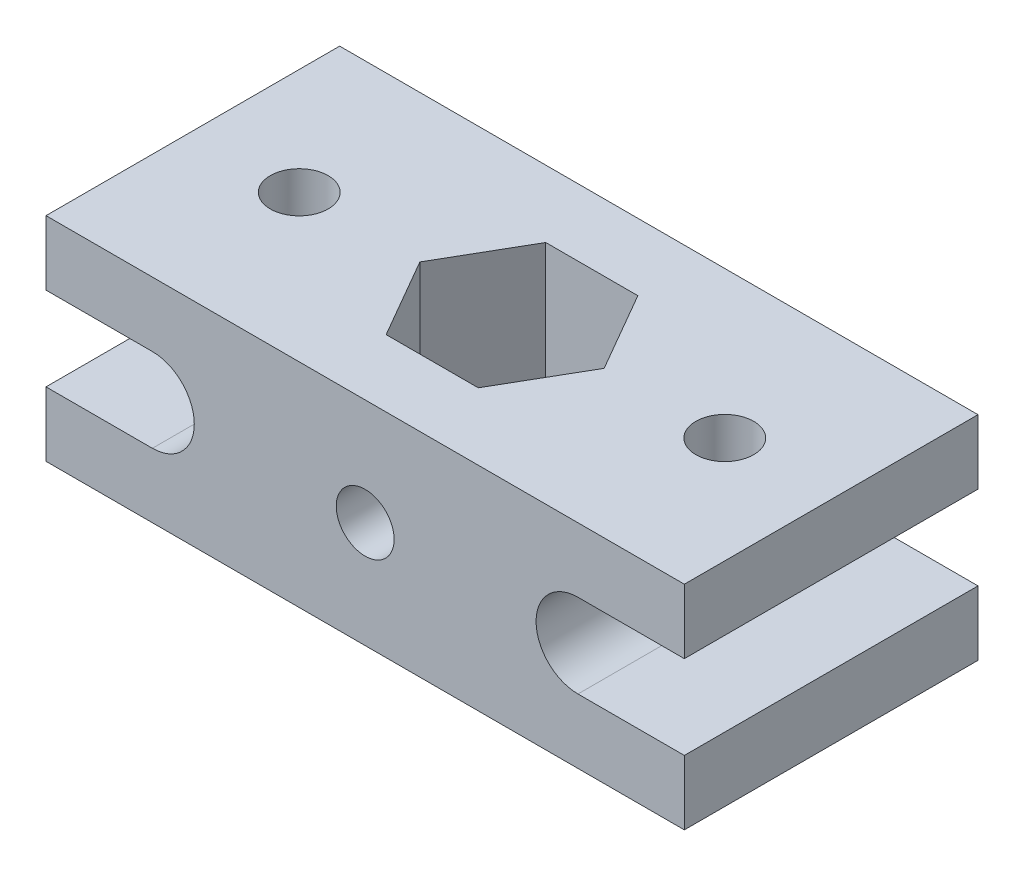
from build123d import *

# Parameters (mm, degrees)
SKETCH1_W                  = 38.1
SKETCH1_H                  = 17.526
BOSS_EXTRUDE1_DEPTH        = 12.7
CUT_EXTRUDE1_DEPTH         = 25.4
F_8_32_TAPPED_HOLE1_REACH  = 26.515
F_8_32_TAPPED_HOLE1_BORE_R = 1.7272
MIRROR1_START              = -8.763
MIRROR1_DEPTH              = 17.526
MIRROR1_START_2            = 8.85
MIRROR1_2_OUTLINE_R        = 1.7272
MIRROR1_2_DEPTH            = 5.15
F_8_32_TAPPED_HOLE2_D      = 3.4544
F_8_32_TAPPED_HOLE2_DEPTH  = 10.668
F_8_32_TAPPED_HOLE2_TIP    = 1.037806461


with BuildPart() as part:
    # Sketch1 → Boss-Extrude1 (new body)
    with BuildSketch(Plane(origin=(0, 0, 0), x_dir=(1, 0, 0), z_dir=(0, 1, 0))):
        Rectangle(SKETCH1_W, SKETCH1_H)
        Polygon((5.499261314, 0), (2.749630657, 4.7625), (-2.749630657, 4.7625), (-5.499261314, 0), (-2.749630657, -4.7625), (2.749630657, -4.7625), align=None, mode=Mode.SUBTRACT)
    extrude(amount=BOSS_EXTRUDE1_DEPTH)

    # Sketch2 → Cut-Extrude1 (cut)
    with BuildSketch(Plane.XY.offset(8.763)):
        with BuildLine():
            Line((12.7, 8.85), (19.05, 8.85))
            ThreePointArc((19.05, 8.85), (21.55, 6.35), (19.05, 3.85))
            Line((19.05, 3.85), (12.7, 3.85))
            ThreePointArc((12.7, 3.85), (10.2, 6.35), (12.7, 8.85))
        make_face()
    extrude(amount=-CUT_EXTRUDE1_DEPTH, mode=Mode.SUBTRACT)

    # #8-32 Tapped Hole1 bore → #8-32 Tapped Hole1 (cut, up to next)
    with BuildSketch(Plane(origin=(0, 12.7, 0), x_dir=(1, 0, 0), z_dir=(0, 1, 0)), mode=Mode.PRIVATE) as f_8_32_tapped_hole1_sk1:
        with Locations((12.7, 0)):
            Circle(F_8_32_TAPPED_HOLE1_BORE_R)
    f_8_32_tapped_hole1_tool1 = extrude(f_8_32_tapped_hole1_sk1.sketch, amount=-F_8_32_TAPPED_HOLE1_REACH, mode=Mode.PRIVATE) & part.part
    add(f_8_32_tapped_hole1_tool1.solids().sort_by_distance((12.7, 12.7, 0))[0], mode=Mode.SUBTRACT)

    # Mirror1: read off the stored shape, not the designer's step
    # Mirror1 outline → Mirror1 (cut)
    with BuildSketch(Plane.XY.offset(MIRROR1_START)):
        with BuildLine():
            Line((-12.7, 8.85), (-19.05, 8.85))
            Line((-19.05, 8.85), (-19.05, 3.85))
            Line((-19.05, 3.85), (-12.7, 3.85))
            ThreePointArc((-12.7, 3.85), (-10.2, 6.35), (-12.7, 8.85))
        make_face()
    extrude(amount=MIRROR1_DEPTH, mode=Mode.SUBTRACT)

    # Mirror1 2 outline → Mirror1 2 (cut)
    with BuildSketch(Plane(origin=(0, 0, 0), x_dir=(1, 0, 0), z_dir=(0, 1, 0)).offset(MIRROR1_START_2)):
        with Locations((-12.7, 0)):
            Circle(MIRROR1_2_OUTLINE_R)
    extrude(amount=MIRROR1_2_DEPTH, mode=Mode.SUBTRACT)

    # #8-32 Tapped Hole2
    with Locations(Plane.XY.offset(8.763)):
        with Locations((0, 6.35)):
            Hole(F_8_32_TAPPED_HOLE2_D / 2, depth=F_8_32_TAPPED_HOLE2_DEPTH)
            with Locations((0, 0, -(F_8_32_TAPPED_HOLE2_DEPTH + F_8_32_TAPPED_HOLE2_TIP / 2))):  # 118° drill point
                Cone(0, F_8_32_TAPPED_HOLE2_D / 2, F_8_32_TAPPED_HOLE2_TIP, mode=Mode.SUBTRACT)


solid = part.part
